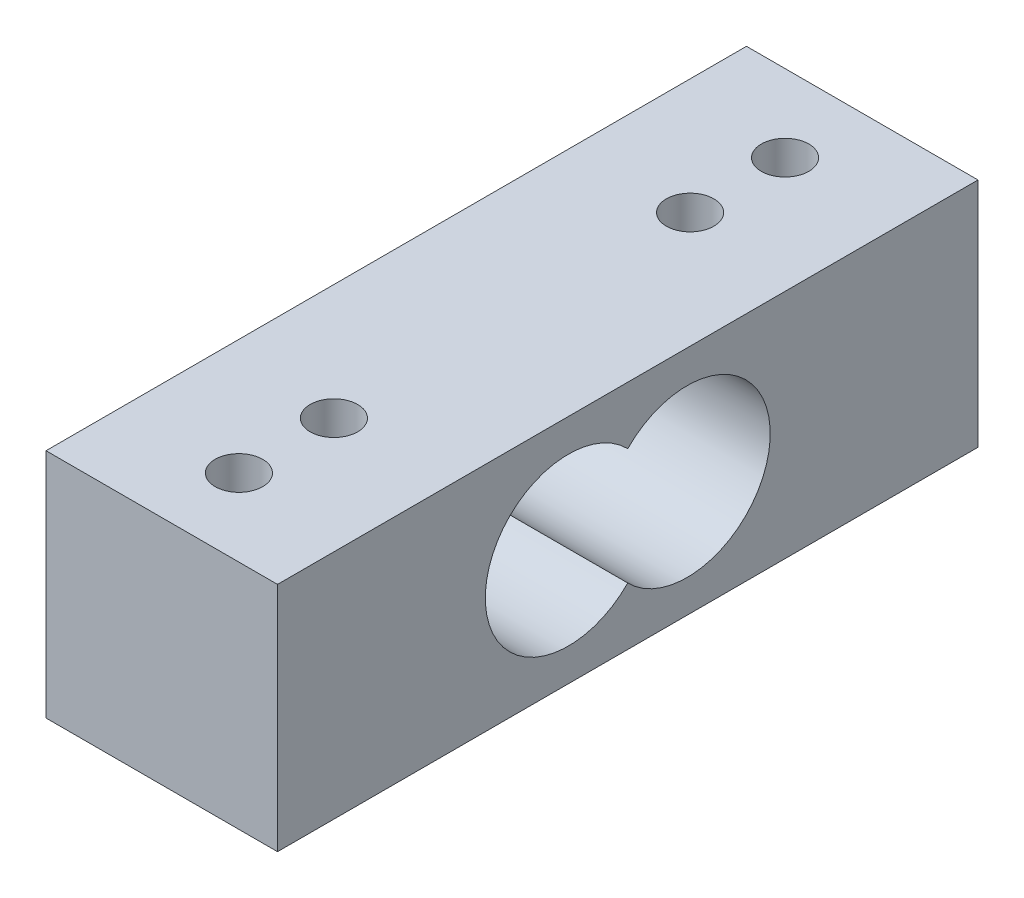
from build123d import *

# Parameters (mm, degrees)
ESQUISSE1_W             = 19.5
ESQUISSE1_H             = 19.5
BOSS_EXTRU_1_DEPTH      = 29.5
ESQUISSE2_R             = 2
ENL_V_MAT_EXTRU_1_DEPTH = 37.68190971
ENL_V_MAT_EXTRU_2_DEPTH = 37.68190971


with BuildPart() as part:
    # Esquisse1 → Boss.-Extru.1 (new, symmetric)
    with BuildSketch(Plane.XY):
        Rectangle(ESQUISSE1_W, ESQUISSE1_H)
    extrude(amount=BOSS_EXTRU_1_DEPTH, both=True)

    # Esquisse2 → Enlèv. mat.-Extru.1 (cut, through all)
    with BuildSketch(Plane(origin=(0, 9.75, 0), x_dir=(1, 0, 0), z_dir=(0, 1, 0))):
        with Locations((0, 23)):
            Circle(ESQUISSE2_R)
        with Locations((0, 15)):
            Circle(ESQUISSE2_R)
        with Locations((0, -15)):
            Circle(ESQUISSE2_R)
        with Locations((0, -23)):
            Circle(ESQUISSE2_R)
    extrude(amount=-ENL_V_MAT_EXTRU_1_DEPTH, mode=Mode.SUBTRACT)

    # Esquisse3 → Enlèv. mat.-Extru.2 (cut, through all)
    with BuildSketch(Plane(origin=(9.75, 0, 0), x_dir=(0, 0, -1), z_dir=(1, 0, 0))):
        with BuildLine():
            ThreePointArc((0, 4.898979486), (-12, 0), (0, -4.898979486))
            ThreePointArc((0, -4.898979486), (12, 0), (0, 4.898979486))
        make_face()
    extrude(amount=-ENL_V_MAT_EXTRU_2_DEPTH, mode=Mode.SUBTRACT)


solid = part.part
